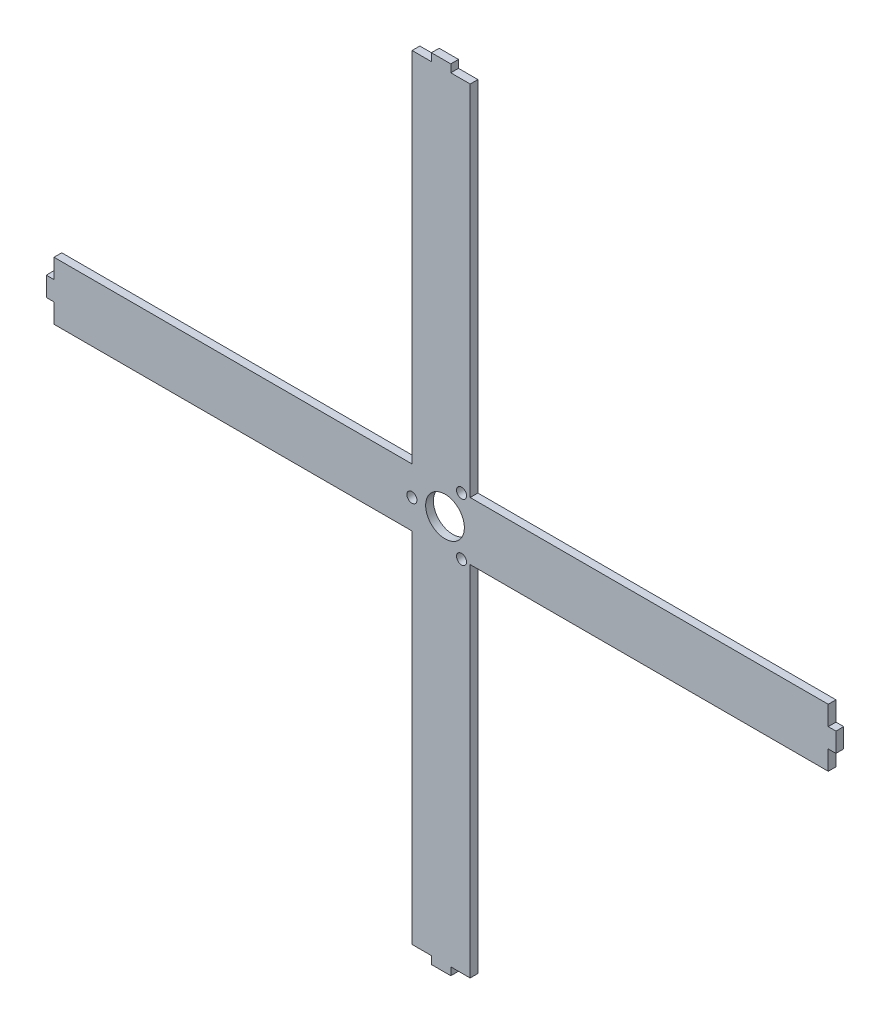
from build123d import *

# Parameters (mm, degrees)
BOSS_EXTRUDE1_DEPTH = 4
CAVITY1_OUTLINE_R   = 2.6
CAVITY1_OUTLINE_R_2 = 10
CAVITY1_DEPTH       = 4


# Read off the part's stored shape, not the designer's step: Cavity1
with BuildPart() as part:
    # Sketch1 → Boss-Extrude1 (new body)
    with BuildSketch(Plane.XY):
        Polygon((363.586470787, 3.889663418), (367.586470787, 3.889663418), (367.586470787, 13.889663418), (363.586470787, 13.889663418), (363.586470787, 23.889663418), (178.577070849, 23.889663418), (178.577070849, 208.900229456), (168.577070849, 208.900229456), (168.577070849, 212.900229456), (158.577070849, 212.900229456), (158.577070849, 208.900229456), (148.577070849, 208.900229456), (148.577070849, 23.889663418), (-36.413529213, 23.889663418), (-36.413529213, 13.889663418), (-40.413529213, 13.889663418), (-40.413529213, 3.889663418), (-36.413529213, 3.889663418), (-36.413529213, -6.110336582), (148.577070849, -6.110336582), (148.577070849, -191.099770544), (158.577070849, -191.099770544), (158.577070849, -195.099770544), (168.577070849, -195.099770544), (168.577070849, -191.099770544), (178.577070849, -191.099770544), (178.577070849, -6.110336582), (363.586470787, -6.110336582), align=None)
    extrude(amount=BOSS_EXTRUDE1_DEPTH)

    # Cavity1 outline → Cavity1 (cut)
    with BuildSketch(Plane.XY):
        with Locations((174.136470787, 23.709263861)):
            Circle(CAVITY1_OUTLINE_R)
        with Locations((174.136470787, -5.908804949)):
            Circle(CAVITY1_OUTLINE_R)
        with Locations((148.486470787, 8.900229456)):
            Circle(CAVITY1_OUTLINE_R)
        with Locations((165.586470787, 8.900229456)):
            Circle(CAVITY1_OUTLINE_R_2)
    extrude(amount=CAVITY1_DEPTH, mode=Mode.SUBTRACT)


solid = part.part
